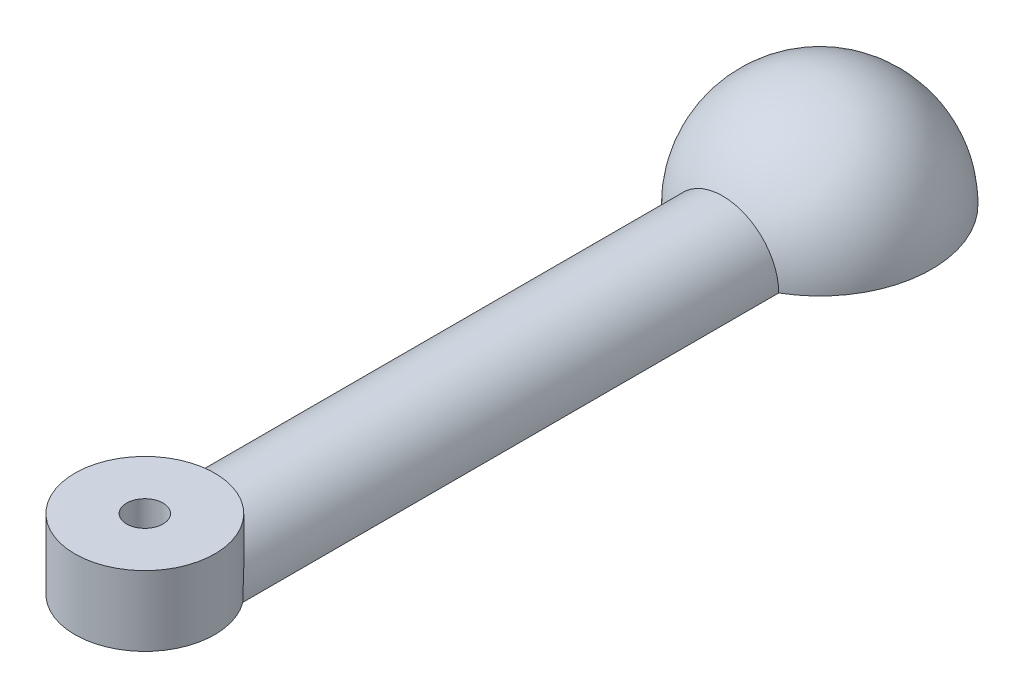
from build123d import *

# Parameters (mm, degrees)
SKETCH1_R                     = 10.16
BOSS_EXTRUDE1_DEPTH           = 101.6
SKETCH3_R                     = 12.7
SKETCH3_R_2                   = 3.302
BOSS_EXTRUDE2_DEPTH           = 12.7
SKETCH5_W                     = 50.328091527
SKETCH5_H                     = 177.713548071
CUT_EXTRUDE2_DEPTH            = 122.062113097
SKETCH4_W                     = 0.976
SKETCH4_H                     = 5
CUT_EXTRUDE3_DEPTH            = 11.684
CUT_EXTRUDE4_DEPTH            = 6.35
CUT_EXTRUDE4_DRAFT            = 5
CUT_EXTRUDE5_DEPTH            = 124.013791019
SKETCH4_5_R                   = 3.175
BOSS_EXTRUDE3_DEPTH           = 3.175
BOSS_EXTRUDE3_TAPER           = 2
BOSS_EXTRUDE3_OTHER_WAY_DEPTH = 3.175
BOSS_EXTRUDE3_OTHER_WAY_TAPER = 2


with BuildPart() as part:
    # Sketch1 → Boss-Extrude1 (new body)
    with BuildSketch(Plane.XY):
        Circle(SKETCH1_R)
    extrude(amount=BOSS_EXTRUDE1_DEPTH)

    # Sketch2 → Revolve1 (revolve)
    with BuildSketch(Plane(origin=(0, 0, 0), x_dir=(0, 0, -1), z_dir=(1, 0, 0))):
        with BuildLine():
            ThreePointArc((37.917636205, 0), (17.597636205, 20.32), (-2.722363795, 0))
            Line((-2.722363795, 0), (37.917636205, 0))
        make_face()
    revolve(axis=Axis((0, 0, 2.722363795), (0, 0, -1)))

    # Sketch3 → Boss-Extrude2 (add, symmetric)
    with BuildSketch(Plane(origin=(0, 0, 0), x_dir=(1, 0, 0), z_dir=(0, 1, 0))):
        with Locations((0, -104.902)):
            Circle(SKETCH3_R)
        with Locations((0, -104.902)):
            Circle(SKETCH3_R_2, mode=Mode.SUBTRACT)
    extrude(amount=BOSS_EXTRUDE2_DEPTH, both=True)

    # Sketch5 → Cut-Extrude2 (cut, through all)
    with BuildSketch(Plane(origin=(0, 0, 0), x_dir=(1, 0, 0), z_dir=(0, 1, 0))):
        with Locations((0.842814929, -41.287007492)):
            Rectangle(SKETCH5_W, SKETCH5_H)
    extrude(amount=-CUT_EXTRUDE2_DEPTH, mode=Mode.SUBTRACT)

    # Sketch4 → Cut-Extrude3 (cut)
    with BuildSketch(Plane(origin=(0, 0, 0), x_dir=(1, 0, 0), z_dir=(0, 1, 0))):
        Polygon((-1.524, 11.040636205), (-1.524, 6.040636205), (1.524, 6.040636205), (1.524, 29.154636205), (-1.524, 29.154636205), (-1.524, 24.154636205), align=None)
        with Locations((-2.012, 8.540636205)):
            Rectangle(SKETCH4_W, SKETCH4_H)
        with Locations((-2.012, 26.654636205)):
            Rectangle(SKETCH4_W, SKETCH4_H)
    extrude(amount=CUT_EXTRUDE3_DEPTH, mode=Mode.SUBTRACT)


with BuildPart() as cut_extrude4_tool:
    # Sketch4<3> → Cut-Extrude4 (with draft: the straight prism first)
    with BuildSketch(Plane(origin=(0, 0, 0), x_dir=(1, 0, 0), z_dir=(0, 1, 0))):
        with BuildLine():
            ThreePointArc((-2.5, -79.502), (-4.743562056, -84.918437944), (-10.16, -87.162))
            Line((-10.16, -87.162), (-10.16, -92.162))
            ThreePointArc((-10.16, -92.162), (-1.20802815, -88.45397185), (2.5, -79.502))
            Line((2.5, -79.502), (2.5, 6.040636205))
            Line((2.5, 6.040636205), (-2.5, 6.040636205))
            Line((-2.5, 6.040636205), (-2.5, -79.502))
        make_face()
    extrude(amount=CUT_EXTRUDE4_DEPTH)
    # Cut-Extrude4: the draft: its side faces are tilted about the plane it starts from
    cut_extrude4_sides = [cut_extrude4_tool.faces().sort_by_distance(p)[0] for p in [
        (-4.743562056, 3.175, 84.918437944),
        (-10.16, 3.175, 89.662),
        (-1.20802815, 3.175, 88.45397185),
        (2.5, 3.175, 36.730681898),
        (0, 3.175, -6.040636205),
        (-2.5, 3.175, 36.730681898),
    ]]
    draft(cut_extrude4_sides, Plane(origin=(0, 0, 0), x_dir=(1, 0, 0), z_dir=(0, 1, 0)), CUT_EXTRUDE4_DRAFT)


with BuildPart() as part_1:
    add(part.part)

    # Cut-Extrude4: cut by cut_extrude4_tool
    add(cut_extrude4_tool.part, mode=Mode.SUBTRACT)

    # Sketch7 → Cut-Extrude5 (cut, through all)
    with BuildSketch(Plane(origin=(-10.082823385, 0.882132743, 0), x_dir=(0, 0, -1), z_dir=(0.9961946980917457, -0.08715574274765836, 1.0368733976540235e-15))):
        Polygon((-92.162, -0.885502346), (-92.006694168, 0.885502346), (-87.314828647, 0.885502346), (-87.162, -0.885502346), align=None)
    extrude(amount=-CUT_EXTRUDE5_DEPTH, mode=Mode.SUBTRACT)

    # Sketch4<5> → Boss-Extrude3 (add)
    with BuildSketch(Plane(origin=(0, 0, 0), x_dir=(1, 0, 0), z_dir=(0, 1, 0))):
        with Locations((-11.43, 17.597636205)):
            Circle(SKETCH4_5_R)
        with Locations((11.43, 17.597636205)):
            Circle(SKETCH4_5_R)
        with Locations((0, -92.202)):
            Circle(SKETCH4_5_R)
    extrude(amount=BOSS_EXTRUDE3_DEPTH, taper=BOSS_EXTRUDE3_TAPER)

    # Sketch4<5> → Boss-Extrude3 other way (add)
    with BuildSketch(Plane(origin=(0, 0, 0), x_dir=(1, 0, 0), z_dir=(0, 1, 0))):
        with Locations((-11.43, 17.597636205)):
            Circle(SKETCH4_5_R)
        with Locations((11.43, 17.597636205)):
            Circle(SKETCH4_5_R)
        with Locations((0, -92.202)):
            Circle(SKETCH4_5_R)
    extrude(amount=-BOSS_EXTRUDE3_OTHER_WAY_DEPTH, taper=BOSS_EXTRUDE3_OTHER_WAY_TAPER)


solid = part_1.part
